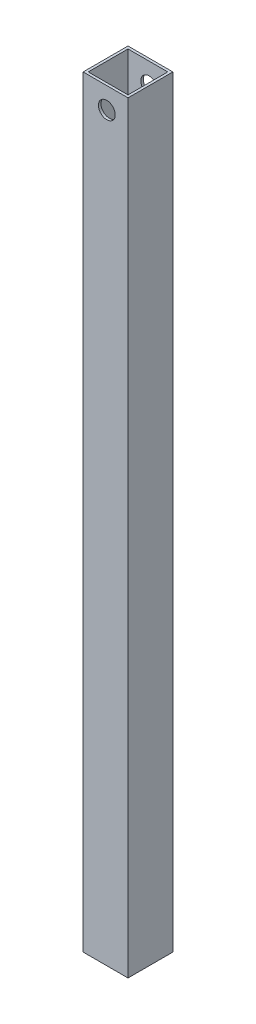
from build123d import *

# Parameters (mm, degrees)
SKETCH1_W           = 26.924
SKETCH1_H           = 26.924
SKETCH1_W_2         = 23.876
SKETCH1_H_2         = 23.876
EXTRUDE_THIN1_DEPTH = 457.2
SKETCH2_R           = 5.0419
CUT_EXTRUDE1_DEPTH  = 459.189881185


with BuildPart() as part:
    # Sketch1 → Extrude-Thin1 (new body)
    with BuildSketch(Plane(origin=(0, 0, 0), x_dir=(1, 0, 0), z_dir=(0, 1, 0))):
        Rectangle(SKETCH1_W, SKETCH1_H)
        Rectangle(SKETCH1_W_2, SKETCH1_H_2, mode=Mode.SUBTRACT)
    extrude(amount=EXTRUDE_THIN1_DEPTH)

    # Sketch2 → Cut-Extrude1 (cut, through all)
    with BuildSketch(Plane.XY.offset(13.462)):
        with Locations((0.762, 444.5)):
            Circle(SKETCH2_R)
    extrude(amount=-CUT_EXTRUDE1_DEPTH, mode=Mode.SUBTRACT)


solid = part.part
